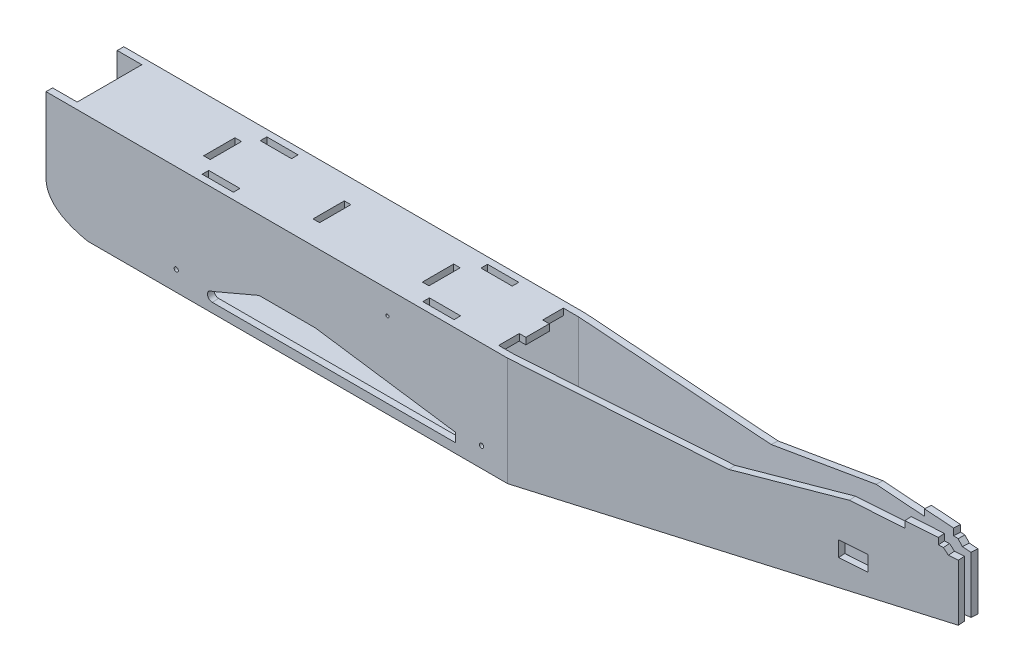
from build123d import *

# Parameters (mm, degrees)
BOSS_EXTRUDE1_DEPTH                    = 5.334
SKETCH3_W                              = 342.632808843
SKETCH3_H                              = 26.289
BOSS_EXTRUDE2_DEPTH                    = 5.334
BOSS_EXTRUDE5_START                    = -5.334
BOSS_EXTRUDE5_DEPTH                    = 5.334
POWER_POD_SLOTS_REACH                  = 727.726
SKETCH13_W                             = 25.4
SKETCH13_H                             = 5.334
ELEVATOR_TABS_DEPTH                    = 5.334
SKETCH19_W                             = 19.05
SKETCH19_H                             = 5.334
FORMER_TAB_DEPTH                       = 5.334
RUDDER_SERVO_SLOT_REACH                = 728.753
SKETCH16_W                             = 22.5
SKETCH16_H                             = 12.5
ELEVATOR_SERVO_SLOT_REACH              = 725.169
SKETCH17_W                             = 22.5
SKETCH17_H                             = 12.5
FORMER_SLOTS_REACH                     = 727.726
SKETCH26_W                             = 5.334
SKETCH26_H                             = 25.4
SKETCH21_W                             = 250.425843048
SKETCH21_H                             = 52.578
UNDERBELLY_DEPTH                       = 5.334
SKETCH21_6_W                           = 38.1
SKETCH21_6_H                           = 52.578
REMOVABLE_WING_SUPPORT_DEPTH           = 5.334
ANGLED_UNDERBELLY_DEPTH                = 5.334
SKETCH28_R                             = 1.7399
F_15_CRUSH_REMOVABLE_WING_MOUNTS_DEPTH = 727.171052045
SKETCH30_R                             = 1.27
BBQ_SKEWER_HOLES_DEPTH                 = 727.171052045


# Read off the part's stored shape, not the designer's step: Boss-Extrude5
with BuildPart() as part:
    # Sketch2 → Boss-Extrude1 (new body)
    with BuildSketch(Plane.XY):
        with BuildLine():
            Line((375.332808843, 0), (0, 0))
            Line((0, 0), (0, -60.43360552))
            add(Edge.make_bspline(
                [(0, -60.43360552), (0, -75.756990751), (13.319871138, -83.937776911), (33.52399345, -88.361758411)],
                knots=[0, 0, 0, 0, 0.085212973, 0.085212973, 0.085212973, 0.085212973], degree=3))
            Line((33.52399345, -88.361758411), (375.332808843, -88.361758411))
            Line((375.332808843, -88.361758411), (375.332808843, 0))
        make_face()
        with BuildLine():
            Line((173.201240555, -80.741758411), (135.066965795, -80.741758411))
            ThreePointArc((135.066965795, -80.741758411), (131.256965795, -76.931758411), (135.066965795, -73.121758411))
            Line((135.066965795, -73.121758411), (173.201240555, -56.865758411))
            Line((173.201240555, -56.865758411), (218.892549783, -56.865758411))
            Line((218.892549783, -56.865758411), (332.866595595, -73.375758411))
            Line((332.866595595, -73.375758411), (332.866595595, -80.741758411))
            Line((332.866595595, -80.741758411), (218.892549783, -80.741758411))
            Line((218.892549783, -80.741758411), (173.201240555, -80.741758411))
        make_face(mode=Mode.SUBTRACT)
    boss_extrude1 = extrude(amount=BOSS_EXTRUDE1_DEPTH)

    # Sketch3 → Boss-Extrude2 (add)
    with BuildSketch(Plane(origin=(0, 0, 0), x_dir=(1, 0, 0), z_dir=(0, 1, 0))):
        with Locations((191.316404422, 13.1445)):
            Rectangle(SKETCH3_W, SKETCH3_H)
    boss_extrude2 = extrude(amount=-BOSS_EXTRUDE2_DEPTH)

    # Boss-Extrude5 outline → Boss-Extrude5 (add)
    with BuildSketch(Plane(origin=(2.141983772, 0, 31.065619336), x_dir=(0.9976313703333219, 0, -0.0687869822485207), z_dir=(0.0687869822485207, 0, 0.9976313703333219)).offset(BOSS_EXTRUDE5_START)):
        Polygon((717.552437166, -28.507984923), (717.552437166, 17.312222731), (709.949782932, 17.312222731), (706.212906654, 20.95112249), (634.474168953, 20.95112249), (542.63206433, 0), (374.076874654, 0), (374.076874654, -88.361758411), align=None)
    boss_extrude5 = extrude(amount=BOSS_EXTRUDE5_DEPTH)

    # Mirror4: Boss-Extrude1, Boss-Extrude2, Boss-Extrude5 across plane
    add(boss_extrude1.mirror(Plane(origin=(20, -5.334, -26.289), x_dir=(1, 0, 0), z_dir=(0, 0, -1))))
    add(boss_extrude2.mirror(Plane(origin=(20, -5.334, -26.289), x_dir=(1, 0, 0), z_dir=(0, 0, -1))))
    add(boss_extrude5.mirror(Plane(origin=(20, -5.334, -26.289), x_dir=(1, 0, 0), z_dir=(0, 0, -1))))

    # Sketch13 → Power Pod Slots (cut, up to next)
    with BuildSketch(Plane(origin=(0, 0, 0), x_dir=(1, 0, 0), z_dir=(0, 1, 0)), mode=Mode.PRIVATE) as power_pod_slots_sk1:
        with Locations((313.6875, 49.911)):
            Rectangle(SKETCH13_W, SKETCH13_H)
    power_pod_slots_tool1 = extrude(power_pod_slots_sk1.sketch, amount=-POWER_POD_SLOTS_REACH, mode=Mode.PRIVATE) & part.part
    # Sketch13 → Power Pod Slots (cut, up to next)
    with BuildSketch(Plane(origin=(0, 0, 0), x_dir=(1, 0, 0), z_dir=(0, 1, 0)), mode=Mode.PRIVATE) as power_pod_slots_sk2:
        with Locations((313.6875, 2.667)):
            Rectangle(SKETCH13_W, SKETCH13_H)
    power_pod_slots_tool2 = extrude(power_pod_slots_sk2.sketch, amount=-POWER_POD_SLOTS_REACH, mode=Mode.PRIVATE) & part.part
    # Sketch13 → Power Pod Slots (cut, up to next)
    with BuildSketch(Plane(origin=(0, 0, 0), x_dir=(1, 0, 0), z_dir=(0, 1, 0)), mode=Mode.PRIVATE) as power_pod_slots_sk3:
        with Locations((134.3, 2.667)):
            Rectangle(SKETCH13_W, SKETCH13_H)
    power_pod_slots_tool3 = extrude(power_pod_slots_sk3.sketch, amount=-POWER_POD_SLOTS_REACH, mode=Mode.PRIVATE) & part.part
    # Sketch13 → Power Pod Slots (cut, up to next)
    with BuildSketch(Plane(origin=(0, 0, 0), x_dir=(1, 0, 0), z_dir=(0, 1, 0)), mode=Mode.PRIVATE) as power_pod_slots_sk4:
        with Locations((134.3, 49.911)):
            Rectangle(SKETCH13_W, SKETCH13_H)
    power_pod_slots_tool4 = extrude(power_pod_slots_sk4.sketch, amount=-POWER_POD_SLOTS_REACH, mode=Mode.PRIVATE) & part.part
    add(power_pod_slots_tool1.solids().sort_by_distance((313.6875, 0, -49.911))[0], mode=Mode.SUBTRACT)
    add(power_pod_slots_tool2.solids().sort_by_distance((313.6875, 0, -2.667))[0], mode=Mode.SUBTRACT)
    add(power_pod_slots_tool3.solids().sort_by_distance((134.3, 0, -2.667))[0], mode=Mode.SUBTRACT)
    add(power_pod_slots_tool4.solids().sort_by_distance((134.3, 0, -49.911))[0], mode=Mode.SUBTRACT)

    # Sketch14 → Elevator Tabs (add)
    with BuildSketch(Plane(origin=(0, 20.95112249, 0), x_dir=(1, 0, 0), z_dir=(0, 1, 0))):
        Polygon((702.790902865, 35.333666188), (677.451066058, 37.080855537), (677.084156295, 31.759489808), (702.423993101, 30.012300459), align=None)
        Polygon((702.790902865, 17.244333812), (702.423993101, 22.565699541), (677.084156295, 20.818510192), (677.451066058, 15.497144463), align=None)
    extrude(amount=ELEVATOR_TABS_DEPTH)

    # Sketch19 → Former Tab (add)
    with BuildSketch(Plane(origin=(362.632808843, 0, 0), x_dir=(0, 0, -1), z_dir=(1, 0, 0))):
        with Locations((26.289, -2.667)):
            Rectangle(SKETCH19_W, SKETCH19_H)
    extrude(amount=FORMER_TAB_DEPTH)

    # Sketch16 → Rudder Servo Slot (cut, up to next)
    with BuildSketch(Plane(origin=(2.141983772, 0, 31.065619336), x_dir=(0.9976313703333219, 0, -0.06878698224852071), z_dir=(0.06878698224852071, 0, 0.997631370333322)), mode=Mode.PRIVATE) as rudder_servo_slot_sk1:
        with Locations((637.616437166, -16.923984923)):
            Rectangle(SKETCH16_W, SKETCH16_H)
    rudder_servo_slot_tool1 = extrude(rudder_servo_slot_sk1.sketch, amount=-RUDDER_SERVO_SLOT_REACH, mode=Mode.PRIVATE) & part.part
    add(rudder_servo_slot_tool1.solids().sort_by_distance((638.248144, -16.923985, -12.794091))[0], mode=Mode.SUBTRACT)

    # Sketch17 → Elevator Servo Slot (cut, up to next)
    with BuildSketch(Plane(origin=(5.750099145, 0, -83.394838699), x_dir=(-0.9976313703333219, 0, -0.06878698224852071), z_dir=(0.06878698224852071, 0, -0.997631370333322)), mode=Mode.PRIVATE) as elevator_servo_slot_sk1:
        with Locations((-633.999755214, -3.461984923)):
            Rectangle(SKETCH17_W, SKETCH17_H)
    elevator_servo_slot_tool1 = extrude(elevator_servo_slot_sk1.sketch, amount=-ELEVATOR_SERVO_SLOT_REACH, mode=Mode.PRIVATE) & part.part
    add(elevator_servo_slot_tool1.solids().sort_by_distance((638.248144, -3.461985, -39.783909))[0], mode=Mode.SUBTRACT)

    # Sketch26 → Former Slots (cut, up to next)
    with BuildSketch(Plane(origin=(0, 0, 0), x_dir=(1, 0, 0), z_dir=(0, 1, 0)), mode=Mode.PRIVATE) as former_slots_sk1:
        with Locations((200.810432831, 26.289)):
            Rectangle(SKETCH26_W, SKETCH26_H)
    former_slots_tool1 = extrude(former_slots_sk1.sketch, amount=-FORMER_SLOTS_REACH, mode=Mode.PRIVATE) & part.part
    # Sketch26 → Former Slots (cut, up to next)
    with BuildSketch(Plane(origin=(0, 0, 0), x_dir=(1, 0, 0), z_dir=(0, 1, 0)), mode=Mode.PRIVATE) as former_slots_sk2:
        with Locations((111.910432831, 26.289)):
            Rectangle(SKETCH26_W, SKETCH26_H)
    former_slots_tool2 = extrude(former_slots_sk2.sketch, amount=-FORMER_SLOTS_REACH, mode=Mode.PRIVATE) & part.part
    # Sketch26 → Former Slots (cut, up to next)
    with BuildSketch(Plane(origin=(0, 0, 0), x_dir=(1, 0, 0), z_dir=(0, 1, 0)), mode=Mode.PRIVATE) as former_slots_sk3:
        with Locations((289.710432831, 26.289)):
            Rectangle(SKETCH26_W, SKETCH26_H)
    former_slots_tool3 = extrude(former_slots_sk3.sketch, amount=-FORMER_SLOTS_REACH, mode=Mode.PRIVATE) & part.part
    add(former_slots_tool1.solids().sort_by_distance((200.810433, 0, -26.289))[0], mode=Mode.SUBTRACT)
    add(former_slots_tool2.solids().sort_by_distance((111.910433, 0, -26.289))[0], mode=Mode.SUBTRACT)
    add(former_slots_tool3.solids().sort_by_distance((289.710433, 0, -26.289))[0], mode=Mode.SUBTRACT)

    # Sketch21 → Underbelly (add)
    with BuildSketch(Plane.XZ.offset(88.361758411)):
        with Locations((250.119887319, -26.289)):
            Rectangle(SKETCH21_W, SKETCH21_H)
    extrude(amount=-UNDERBELLY_DEPTH)

    # Sketch28 → 15% Crush Removable Wing Mounts (cut, through all)
    with BuildSketch(Plane.XY.offset(5.334)):
        with Locations((354.099702219, -72.220058411)):
            Circle(SKETCH28_R)
        with Locations((105.856965795, -72.220058411)):
            Circle(SKETCH28_R)
    extrude(amount=-F_15_CRUSH_REMOVABLE_WING_MOUNTS_DEPTH, mode=Mode.SUBTRACT)

    # Sketch30 → BBQ Skewer Holes (cut, through all)
    with BuildSketch(Plane.XY.offset(5.334)):
        with Locations((277.588484301, -19.110387516)):
            Circle(SKETCH30_R)
    extrude(amount=-BBQ_SKEWER_HOLES_DEPTH, mode=Mode.SUBTRACT)


with BuildPart() as body_2:
    # Sketch21<6> → Removable Wing Support (new body)
    with BuildSketch(Plane.XZ.offset(88.361758411)):
        with Locations((105.856965795, -26.289)):
            Rectangle(SKETCH21_6_W, SKETCH21_6_H)
    extrude(amount=-REMOVABLE_WING_SUPPORT_DEPTH)


with BuildPart() as body_3:
    # Sketch25 → Angled Underbelly (new body)
    with BuildSketch(Plane(origin=(26.128255959, -149.423722322, 0), x_dir=(-0.985053848047073, -0.17224667325569476, 0), z_dir=(0.17224667325569476, -0.985053848047073, 0))):
        Polygon((-354.514047872, 52.565335732), (-354.514047872, 0.012664268), (-595.814047872, 16.402222618), (-595.814047872, 36.175777382), align=None)
    extrude(amount=-ANGLED_UNDERBELLY_DEPTH)


solid = Compound([part.part, body_2.part, body_3.part])
